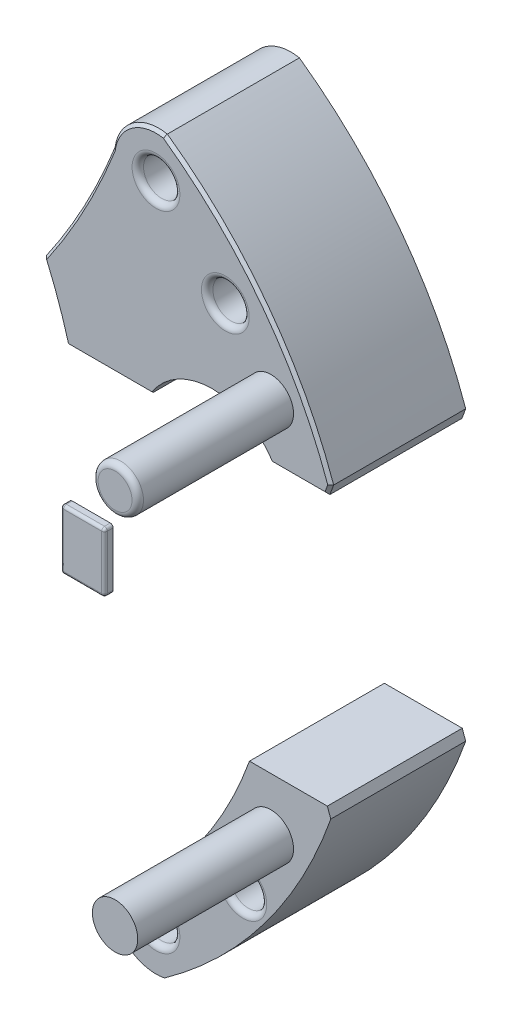
from build123d import *

# Parameters (mm, degrees)
EXTRUDE1_DEPTH      = 47.15
SKETCH6_R           = 6.35
CUT_EXTRUDE1_DEPTH  = 204.208666026
FILLET2_R           = 2
FILLET4_R           = 2
SKETCH8_W           = 65.70292375
SKETCH8_H           = 93.754774622
CUT_EXTRUDE3_DEPTH  = 204.208666026
CHAMFER2_SIZE       = 1
SKETCH9_R           = 139.7
CUT_EXTRUDE4_DEPTH  = 50
SKETCH11_R          = 25
CUT_EXTRUDE6_DEPTH  = 214.843866987
EXTRUDE3_DEPTH      = 20
EXTRUDE3_DEPTH_BACK = 34.45
SKETCH13_R          = 7.928043211
FILLET5_R           = 2
SKETCH14_W          = 15.303172184
SKETCH14_H          = 20.853792668
EXTRUDE4_DEPTH      = 3
FILLET7_R           = 1
FILLET8_R           = 1


with BuildPart() as part:
    # Sketch3 → Extrude1 (new body)
    with BuildSketch(Plane.XY):
        with BuildLine():
            ThreePointArc((50.135487095, 69.198750466), (64.525866494, -0.305809979), (50.135487095, -69.810370425))
            ThreePointArc((50.135487095, -69.810370425), (63.45857204, -91.549610055), (74.200455137, -114.673430667))
            ThreePointArc((74.200455137, -114.673430667), (80.493774475, -125.169476107), (92.452973513, -127.767628632))
            ThreePointArc((92.452973513, -127.767628632), (127.479136393, -93.679325746), (150.571524888, -50.602811572))
            ThreePointArc((150.571524888, -50.602811572), (143.857356878, -25.875125735), (142.199469451, -0.305809979))
            ThreePointArc((142.199469451, -0.305809979), (143.857356878, 25.263505776), (150.571524888, 49.991191613))
            ThreePointArc((150.571524888, 49.991191613), (127.479136393, 93.067705787), (92.452973513, 127.156008673))
            ThreePointArc((92.452973513, 127.156008673), (80.493774475, 124.557856149), (74.200455137, 114.061810708))
            ThreePointArc((74.200455137, 114.061810708), (63.45857204, 90.937990097), (50.135487095, 69.198750466))
        make_face()
    extrude(amount=EXTRUDE1_DEPTH)

    # Sketch6 → Cut-Extrude1 (cut, through all)
    with BuildSketch(Plane.XY.offset(47.15)):
        with Locations((89.47561948, 112.037708566)):
            Circle(SKETCH6_R)
        with Locations((89.47561948, -112.649328525)):
            Circle(SKETCH6_R)
        with Locations((113.713853194, 87.037708566)):
            Circle(SKETCH6_R)
        with Locations((119.828025898, -87.649328525)):
            Circle(SKETCH6_R)
    extrude(amount=-CUT_EXTRUDE1_DEPTH, mode=Mode.SUBTRACT)

    # Fillet2
    fillet2_edges = [part.edges().sort_by_distance(p)[0] for p in [
        (113.478025898, -87.649328525, 47.15),
    ]]
    fillet(fillet2_edges, radius=FILLET2_R)

    # Fillet4
    fillet4_edges = [part.edges().sort_by_distance(p)[0] for p in [
        (83.12561948, 112.037708566, 47.15),
        (83.12561948, -112.649328525, 47.15),
        (107.363853194, 87.037708566, 47.15),
    ]]
    fillet(fillet4_edges, radius=FILLET4_R)

    # Sketch8 → Cut-Extrude3 (cut, through all)
    with BuildSketch(Plane(origin=(0, 0, 0), x_dir=(0, 0, -1), z_dir=(1, 0, 0))):
        with Locations((-20.563952962, -0.407322691)):
            Rectangle(SKETCH8_W, SKETCH8_H)
    extrude(amount=CUT_EXTRUDE3_DEPTH, mode=Mode.SUBTRACT)


with BuildPart() as cut_extrude3_piece_1:
    # of the separate pieces the step leaves, piece 1, a body of its own (cut_extrude3_pieces)
    add(part.part.solids().sort_by_distance((74.200455137, 114.061810708, 47.15))[0])

    # Chamfer2
    chamfer2_edges = [cut_extrude3_piece_1.edges().sort_by_distance(p)[0] for p in [
        (63.45857204, 90.937990097, 47.15),
    ]]
    chamfer(chamfer2_edges, length=CHAMFER2_SIZE)
    chamfer2_2_edges = [cut_extrude3_piece_1.edges().sort_by_distance(p)[0] for p in [
        (80.493774475, 124.557856149, 47.15),
    ]]
    chamfer(chamfer2_2_edges, length=CHAMFER2_SIZE)
    chamfer2_3_edges = [cut_extrude3_piece_1.edges().sort_by_distance(p)[0] for p in [
        (128.375850758, 91.865433078, 47.15),
    ]]
    chamfer(chamfer2_3_edges, length=CHAMFER2_SIZE)
    chamfer2_4_edges = [cut_extrude3_piece_1.edges().sort_by_distance(p)[0] for p in [
        (149.648335334, 47.500481851, 47.15),
    ]]
    chamfer(chamfer2_4_edges, length=CHAMFER2_SIZE)
    chamfer2_5_edges = [cut_extrude3_piece_1.edges().sort_by_distance(p)[0] for p in [
        (103.192563129, 46.47006462, 47.15),
    ]]
    chamfer(chamfer2_5_edges, length=CHAMFER2_SIZE)
    chamfer2_6_edges = [cut_extrude3_piece_1.edges().sort_by_distance(p)[0] for p in [
        (54.562850398, 57.906883046, 47.15),
    ]]
    chamfer(chamfer2_6_edges, length=CHAMFER2_SIZE)

    # Sketch11 → Cut-Extrude6 (cut, through all)
    with BuildSketch(Plane.XY.offset(81.6)):
        with Locations((109.137313189, 33.934290249)):
            Circle(SKETCH11_R)
    extrude(amount=-CUT_EXTRUDE6_DEPTH, mode=Mode.SUBTRACT)


with BuildPart() as cut_extrude3_piece_2:
    # of the separate pieces the step leaves, piece 2, a body of its own (cut_extrude3_pieces)
    add(part.part.solids().sort_by_distance((149.354578468, -47.284710002, 47.15))[0])

    # Sketch9 → Cut-Extrude4 (cut)
    with BuildSketch(Plane.XY):
        with Locations((-9.312477076, 0)):
            Circle(SKETCH9_R)
    extrude(amount=CUT_EXTRUDE4_DEPTH, mode=Mode.SUBTRACT)

    # Sketch13 → Extrude3 (add, two sides: drawn at the far end of the back side and taken through both)
    with BuildSketch(Plane.XY.offset(81.6).offset(-EXTRUDE3_DEPTH_BACK)):
        with Locations((129.622289656, 65.566628934)):
            Circle(SKETCH13_R)
        with Locations((129.622289656, -66.178248893)):
            Circle(SKETCH13_R)
    extrude(amount=EXTRUDE3_DEPTH + EXTRUDE3_DEPTH_BACK)


with BuildPart() as extrude3_piece_1:
    # of the separate pieces the step leaves, piece 1, a body of its own (extrude3_pieces)
    add(cut_extrude3_piece_2.part.solids().sort_by_distance((150.571524888, -50.602811572, 47.15))[0])


with BuildPart() as extrude3_piece_2:
    # of the separate pieces the step leaves, piece 2, a body of its own (extrude3_pieces)
    add(cut_extrude3_piece_2.part.solids().sort_by_distance((137.550332867, 65.566628934, 81.6))[0])

    # Fillet5
    fillet5_edges = [extrude3_piece_2.edges().sort_by_distance(p)[0] for p in [
        (121.694246445, 65.566628934, 101.6),
    ]]
    fillet(fillet5_edges, radius=FILLET5_R)


with BuildPart() as body_4:
    # Sketch14 → Extrude4 (new body)
    with BuildSketch(Plane.XY.offset(91.6)):
        with Locations((111.289315561, 34.499847247)):
            Rectangle(SKETCH14_W, SKETCH14_H)
    extrude(amount=EXTRUDE4_DEPTH)

    # Fillet7
    fillet7_edges = [body_4.edges().sort_by_distance(p)[0] for p in [
        (103.637729469, 34.499847247, 94.6),
        (111.289315561, 24.072950913, 94.6),
        (118.940901653, 34.499847247, 94.6),
        (111.289315561, 44.926743581, 94.6),
    ]]
    fillet(fillet7_edges, radius=FILLET7_R)

    # Fillet8
    # the kernel refuses this fillet: 1 mm, written as the material it takes off along each edge
    with BuildSketch(Plane(origin=(104.637729469, 43.926743581, 93.6), x_dir=(0, 1, 0), z_dir=(-1, 0, 0))) as fillet8_piece_1_section:
        Polygon((0, 0), (FILLET8_R, 0), (FILLET8_R, -FILLET8_R), (0, -FILLET8_R), align=None)
    fillet8_piece_1 = extrude(amount=FILLET8_R, mode=Mode.PRIVATE)
    fillet8_piece_1 = fillet8_piece_1 - Plane(origin=(104.637729469, 43.926743581, 93.6), x_dir=(0, -0.7071067811865475, -0.7071067811865475), z_dir=(-1, 0, 0)) * Sphere(FILLET8_R, mode=Mode.PRIVATE)
    add(fillet8_piece_1, mode=Mode.SUBTRACT)
    with BuildSketch(Plane(origin=(117.940901653, 43.926743581, 93.6), x_dir=(0, 1, 0), z_dir=(1, 0, 0))) as fillet8_piece_2_section:
        Polygon((0, 0), (FILLET8_R, 0), (FILLET8_R, FILLET8_R), (0, FILLET8_R), align=None)
    fillet8_piece_2 = extrude(amount=FILLET8_R, mode=Mode.PRIVATE)
    fillet8_piece_2 = fillet8_piece_2 - Plane(origin=(117.940901653, 43.926743581, 93.6), x_dir=(0, -0.7071067811865475, -0.7071067811865475), z_dir=(1, 0, 0)) * Sphere(FILLET8_R, mode=Mode.PRIVATE)
    add(fillet8_piece_2, mode=Mode.SUBTRACT)
    with BuildSketch(Plane(origin=(104.637729469, 25.072950913, 93.6), x_dir=(-1, 0, 0), z_dir=(0, -1, 0))) as fillet8_piece_3_section:
        Polygon((0, 0), (FILLET8_R, 0), (FILLET8_R, -FILLET8_R), (0, -FILLET8_R), align=None)
    fillet8_piece_3 = extrude(amount=FILLET8_R, mode=Mode.PRIVATE)
    fillet8_piece_3 = fillet8_piece_3 - Plane(origin=(104.637729469, 25.072950913, 93.6), x_dir=(0.7071067811865475, 0, -0.7071067811865475), z_dir=(0, -1, 0)) * Sphere(FILLET8_R, mode=Mode.PRIVATE)
    add(fillet8_piece_3, mode=Mode.SUBTRACT)
    with BuildSketch(Plane(origin=(117.940901653, 25.072950913, 93.6), x_dir=(1, 0, 0), z_dir=(0, -1, 0))) as fillet8_piece_4_section:
        Polygon((0, 0), (FILLET8_R, 0), (FILLET8_R, FILLET8_R), (0, FILLET8_R), align=None)
    fillet8_piece_4 = extrude(amount=FILLET8_R, mode=Mode.PRIVATE)
    fillet8_piece_4 = fillet8_piece_4 - Plane(origin=(117.940901653, 25.072950913, 93.6), x_dir=(-0.7071067811865475, 0, -0.7071067811865475), z_dir=(0, -1, 0)) * Sphere(FILLET8_R, mode=Mode.PRIVATE)
    add(fillet8_piece_4, mode=Mode.SUBTRACT)
    with BuildSketch(Plane(origin=(118.940901653, 24.072950913, 89.1), x_dir=(-1, 0, 0), z_dir=(0, 0, 1)), Plane(origin=(118.940901653, 44.926743581, 89.1), x_dir=(0, -1, 0), z_dir=(0, 0, 1))) as fillet8_piece_5:
        with BuildLine():
            CenterArc((FILLET8_R, -FILLET8_R), FILLET8_R, 90, 90)
            Line((0, -FILLET8_R), (0, 0))
            Line((0, 0), (FILLET8_R, 0))
        make_face()
    extrude(amount=4.5, mode=Mode.SUBTRACT)
    with BuildSketch(Plane(origin=(103.637729469, 24.072950913, 89.1), x_dir=(1, 0, 0), z_dir=(0, 0, 1)), Plane(origin=(103.637729469, 44.926743581, 89.1), x_dir=(0, -1, 0), z_dir=(0, 0, 1))) as fillet8_piece_6:
        with BuildLine():
            CenterArc((FILLET8_R, FILLET8_R), FILLET8_R, 180, 90)
            Line((0, FILLET8_R), (0, 0))
            Line((0, 0), (FILLET8_R, 0))
        make_face()
    extrude(amount=4.5, mode=Mode.SUBTRACT)


solid = Compound([cut_extrude3_piece_1.part, extrude3_piece_1.part, extrude3_piece_2.part, body_4.part])
